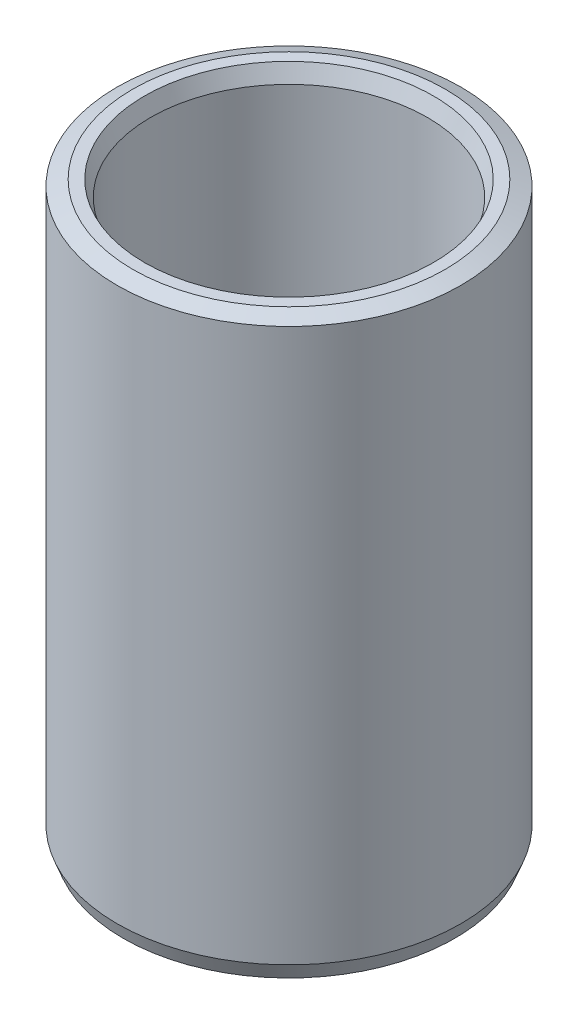
from build123d import *
from OCP.BRepFilletAPI import BRepFilletAPI_MakeChamfer

# Parameters (mm, degrees)
SKETCH1_R           = 50
BOSS_EXTRUDE1_DEPTH = 167.147831734
SKETCH2_R           = 40.278191518
CUT_EXTRUDE1_DEPTH  = 182.489387165
CHAMFER1_SIZE       = 1.747139598
CHAMFER1_SIZE2      = 4.553574891


with BuildPart() as part:
    # Sketch1 → Boss-Extrude1 (new body)
    with BuildSketch(Plane(origin=(0, 0, 0), x_dir=(1, 0, 0), z_dir=(0, 1, 0))):
        Circle(SKETCH1_R)
    extrude(amount=BOSS_EXTRUDE1_DEPTH)

    # Sketch2 → Cut-Extrude1 (cut, through all)
    with BuildSketch(Plane(origin=(0, 0, 0), x_dir=(1, 0, 0), z_dir=(0, 1, 0))):
        Circle(SKETCH2_R)
    extrude(amount=CUT_EXTRUDE1_DEPTH, mode=Mode.SUBTRACT)

    # Chamfer1: one chamfer whose edges measure the first distance from different faces: ONE call of the kernel's chamfer builder (chamfer() names one face for all edges)
    chamfer1_edges_1 = [part.edges().sort_by_distance(p)[0] for p in [
        (-40.278191518, 167.147831734, 0),
    ]]
    chamfer1_side_1 = [part.faces().sort_by_distance(p)[0] for p in [
        (-48.585786438, 167.147831734, 0),
    ]]
    chamfer1_edges_2 = [part.edges().sort_by_distance(p)[0] for p in [
        (-40.278191518, 0, 0),
    ]]
    chamfer1_side_2 = [part.faces().sort_by_distance(p)[0] for p in [
        (-40.278191518, 83.573915867, 0),
    ]]
    chamfer1_edges_3 = [part.edges().sort_by_distance(p)[0] for p in [
        (-50, 0, 0),
    ]]
    chamfer1_side_3 = [part.faces().sort_by_distance(p)[0] for p in [
        (-48.585786438, 0, 0),
    ]]
    chamfer1_edges_4 = [part.edges().sort_by_distance(p)[0] for p in [
        (-50, 167.147831734, 0),
    ]]
    chamfer1_side_4 = [part.faces().sort_by_distance(p)[0] for p in [
        (-50, 83.573915867, 0),
    ]]
    chamfer1 = BRepFilletAPI_MakeChamfer(part.part.solid().wrapped)
    for e in chamfer1_edges_1:
        chamfer1.Add(CHAMFER1_SIZE, CHAMFER1_SIZE2, e.wrapped, chamfer1_side_1[0].wrapped)  # the first distance lies on this face
    for e in chamfer1_edges_2:
        chamfer1.Add(CHAMFER1_SIZE, CHAMFER1_SIZE2, e.wrapped, chamfer1_side_2[0].wrapped)  # the first distance lies on this face
    for e in chamfer1_edges_3:
        chamfer1.Add(CHAMFER1_SIZE, CHAMFER1_SIZE2, e.wrapped, chamfer1_side_3[0].wrapped)  # the first distance lies on this face
    for e in chamfer1_edges_4:
        chamfer1.Add(CHAMFER1_SIZE, CHAMFER1_SIZE2, e.wrapped, chamfer1_side_4[0].wrapped)  # the first distance lies on this face
    add(Compound.cast(chamfer1.Shape()), mode=Mode.REPLACE)


solid = part.part
